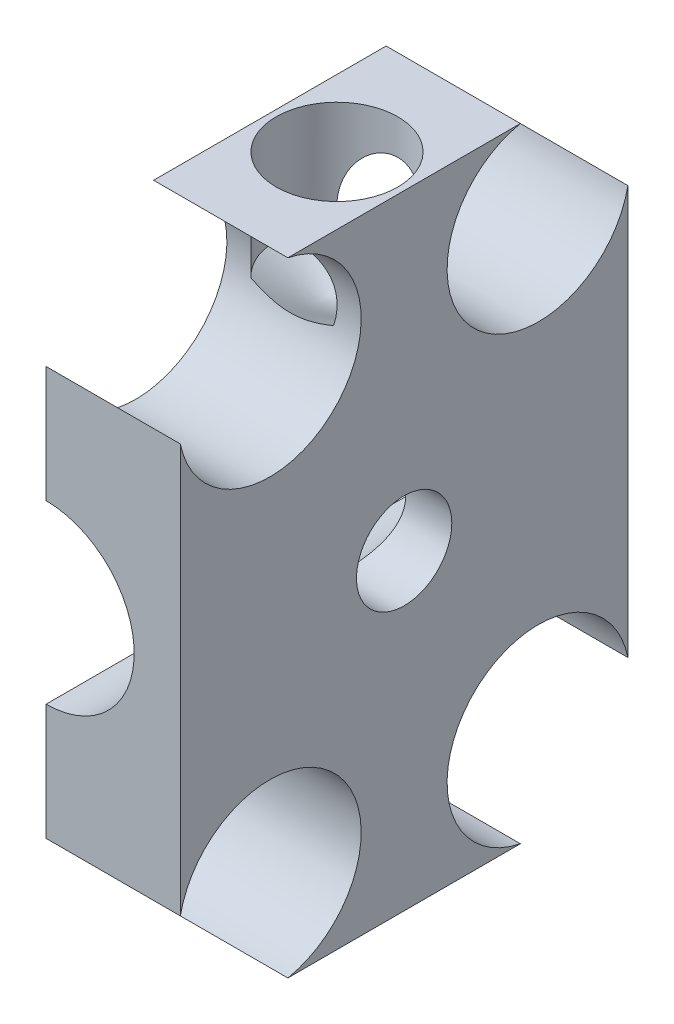
from build123d import *

# Parameters (mm, degrees)
BOSS_EXTRUDE1_DEPTH            = 6.35
F_8_32_TAPPED_HOLE1_D          = 3.4544
F_8_32_TAPPED_HOLE1_DEPTH      = 3.048
F_8_32_TAPPED_HOLE1_TIP        = 1.037806461
F_6_32_TAPPED_HOLE1_D          = 2.7051
F_6_32_TAPPED_HOLE1_DEPTH      = 9.398
F_6_32_TAPPED_HOLE1_TIP        = 0.81269403
F_6_0_204_DIAMETER_HOLE1_DEPTH = 3.81


# Read off the part's stored shape, not the designer's step: #6 (0.204) Diameter Hole1
with BuildPart() as part:
    # Sketch1 → Boss-Extrude1 (new, symmetric)
    with BuildSketch(Plane.XY):
        with BuildLine():
            ThreePointArc((0, -2.499995), (2.499995, 0), (0, 2.499995))
            Line((0, 2.499995), (0, 8.849995))
            Line((0, 8.849995), (3.81, 8.849995))
            Line((3.81, 8.849995), (3.81, -8.849995))
            Line((3.81, -8.849995), (0, -8.849995))
            Line((0, -8.849995), (0, -2.499995))
        make_face()
    extrude(amount=BOSS_EXTRUDE1_DEPTH, both=True)

    # #8-32 Tapped Hole1
    with Locations(Plane(origin=(0, 8.849995, 0), x_dir=(1, 0, 0), z_dir=(0, 1, 0))):
        with Locations((1.905, 0)):
            Hole(F_8_32_TAPPED_HOLE1_D / 2, depth=F_8_32_TAPPED_HOLE1_DEPTH)
            with Locations((0, 0, -(F_8_32_TAPPED_HOLE1_DEPTH + F_8_32_TAPPED_HOLE1_TIP / 2))):  # 118° drill point
                Cone(0, F_8_32_TAPPED_HOLE1_D / 2, F_8_32_TAPPED_HOLE1_TIP, mode=Mode.SUBTRACT)

    # #6-32 Tapped Hole1
    with Locations(Plane(origin=(3.81, 0, 0), x_dir=(0, 0, -1), z_dir=(1, 0, 0))):
        with Locations((0, 0)):
            Hole(F_6_32_TAPPED_HOLE1_D / 2, depth=F_6_32_TAPPED_HOLE1_DEPTH)
            with Locations((0, 0, -(F_6_32_TAPPED_HOLE1_DEPTH + F_6_32_TAPPED_HOLE1_TIP / 2))):  # 118° drill point
                Cone(0, F_6_32_TAPPED_HOLE1_D / 2, F_6_32_TAPPED_HOLE1_TIP, mode=Mode.SUBTRACT)

    # #6 (0.204) Diameter Hole1 outline → #6 (0.204) Diameter Hole1 (cut)
    with BuildSketch(Plane.YZ):
        with BuildLine():
            Line((-8.849995, 6.35), (-8.849995, 3.299466318))
            ThreePointArc((-8.849995, 3.299466318), (-4.478022751, 1.978027751), (-5.799461318, 6.35))
            Line((-5.799461318, 6.35), (-8.849995, 6.35))
        make_face()
        with BuildLine():
            ThreePointArc((-5.799461318, -6.35), (-4.478022751, -1.978027751), (-8.849995, -3.299466318))
            Line((-8.849995, -3.299466318), (-8.849995, -6.35))
            Line((-8.849995, -6.35), (-5.799461318, -6.35))
        make_face()
        with BuildLine():
            Line((8.849995, 6.35), (5.799461318, 6.35))
            ThreePointArc((5.799461318, 6.35), (4.478022751, 1.978027751), (8.849995, 3.299466318))
            Line((8.849995, 3.299466318), (8.849995, 6.35))
        make_face()
        with BuildLine():
            ThreePointArc((8.849995, -3.299466318), (4.478022751, -1.978027751), (5.799461318, -6.35))
            Line((5.799461318, -6.35), (8.849995, -6.35))
            Line((8.849995, -6.35), (8.849995, -3.299466318))
        make_face()
    extrude(amount=F_6_0_204_DIAMETER_HOLE1_DEPTH, mode=Mode.SUBTRACT)


solid = part.part
